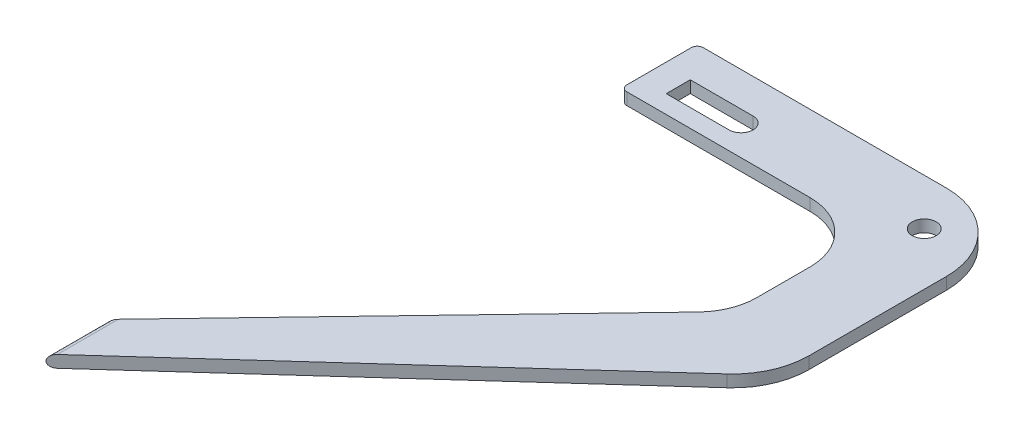
from build123d import *

# Parameters (mm, degrees)
SKETCH1_R           = 2
BOSS_EXTRUDE2_DEPTH = 2
FILLET1_R           = 1
FILLET2_R           = 1


with BuildPart() as part:
    # Sketch1 → Boss-Extrude2 (new body)
    with BuildSketch(Plane(origin=(0, 0, 0), x_dir=(1, 0, 0), z_dir=(0, 1, 0))):
        with BuildLine():
            Line((0, 48.412862342), (0, 37.692030173))
            ThreePointArc((0, 37.692030173), (0.292893219, 36.984923392), (1, 36.692030173))
            Line((1, 36.692030173), (31.48, 36.692030173))
            ThreePointArc((31.48, 36.692030173), (38.551067812, 33.763097985), (41.48, 26.692030173))
            Line((41.48, 26.692030173), (41.48, 17.837278162))
            ThreePointArc((41.48, 17.837278162), (40.75973427, 14.11081444), (38.702693625, 10.92115954))
            Line((38.702693625, 10.92115954), (-9.52, -39.4391308))
            Line((-9.52, -39.4391308), (-9.52, -49.4391308))
            Line((-9.52, -49.4391308), (50.011362769, 4.385719046))
            ThreePointArc((50.011362769, 4.385719046), (53.106383896, 8.659526457), (54.200832168, 13.821577266))
            Line((54.200832168, 13.821577266), (54.200832168, 36.692030173))
            ThreePointArc((54.200832168, 36.692030173), (50.474986688, 45.687016862), (41.48, 49.412862342))
            Line((41.48, 49.412862342), (1, 49.412862342))
            ThreePointArc((1, 49.412862342), (0.292893219, 49.119969123), (0, 48.412862342))
        make_face()
        with Locations(Location((45.48, 41.700609081, 0), (0, 0, 270))):
            Circle(SKETCH1_R, mode=Mode.SUBTRACT)
        with BuildLine():
            Line((15, 43.700609081), (4.549516448, 43.700609081))
            Line((4.549516448, 43.700609081), (4.549516448, 39.700609081))
            Line((4.549516448, 39.700609081), (15, 39.700609081))
            ThreePointArc((15, 39.700609081), (17, 41.700609081), (15, 43.700609081))
        make_face(mode=Mode.SUBTRACT)
    extrude(amount=BOSS_EXTRUDE2_DEPTH)

    # Fillet1
    fillet1_edges = [part.edges().sort_by_distance(p)[0] for p in [
        (-9.52, 2, 44.4391308),
    ]]
    fillet(fillet1_edges, radius=FILLET1_R)

    # Fillet2
    fillet2_edges = [part.edges().sort_by_distance(p)[0] for p in [
        (-9.52, 0, 44.4391308),
    ]]
    fillet(fillet2_edges, radius=FILLET2_R - 0.0001)  # a hair under: the kernel refuses the full size


solid = part.part
